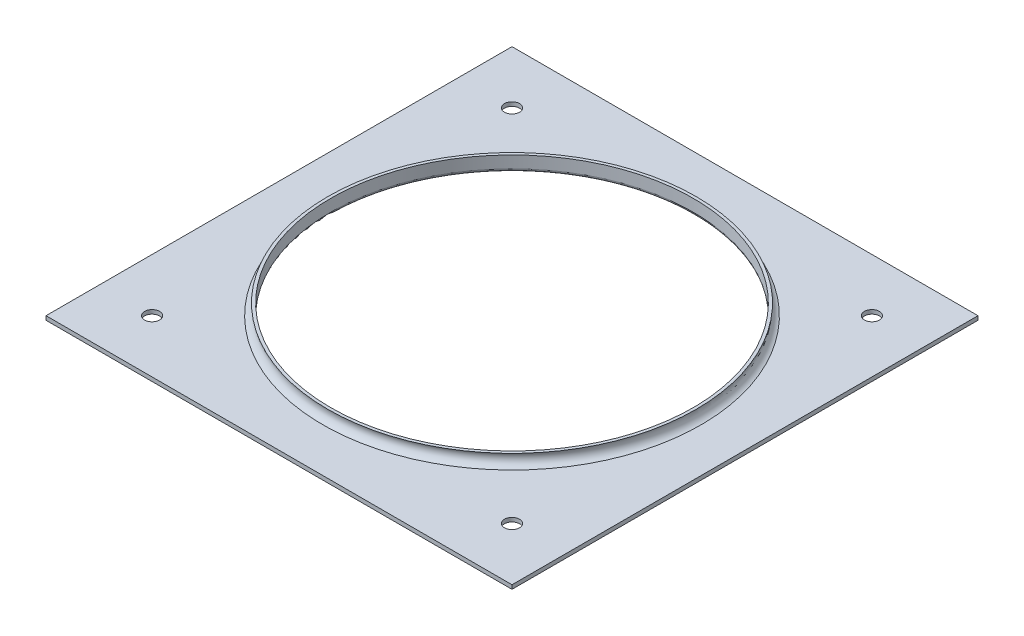
from build123d import *

# Parameters (mm, degrees)
CROQUIS1_W               = 155
CROQUIS1_H               = 155
CROQUIS1_R               = 60.3
SALIENTE_EXTRUIR1_DEPTH  = 8
CORTAR_EXTRUIR4_REACH    = 111.893
CROQUIS3_R               = 3.5
REDONDEO1_R              = 1
CROQUIS5_W               = 161.385983188
CROQUIS5_H               = 158.79059457
CORTAR_EXTRUIR6_DEPTH    = 30
F_5_0_5_DIAMETER_HOLE1_D = 5


with BuildPart() as part:
    # Croquis1 → Saliente-Extruir1 (new body)
    with BuildSketch(Plane(origin=(0, 0, 0), x_dir=(1, 0, 0), z_dir=(0, 1, 0))):
        Rectangle(CROQUIS1_W, CROQUIS1_H)
        Circle(CROQUIS1_R, mode=Mode.SUBTRACT)
    extrude(amount=SALIENTE_EXTRUIR1_DEPTH)

    # Croquis2 → Cortar-Revolución1 (revolve, cut)
    with BuildSketch(Plane.XY):
        with BuildLine():
            Line((63.057831326, 6.474140719), (73.221363367, 6.474140719))
            Line((73.221363367, 6.474140719), (118.605663226, 6.474140719))
            Line((118.605663226, 6.474140719), (118.605663226, 1.329441432))
            Line((118.605663226, 1.329441432), (77.5, 1.329441432))
            Line((77.5, 1.329441432), (62.888920691, 1.329441432))
            ThreePointArc((62.888920691, 1.329441432), (61.030350251, 3.965584448), (63.057831326, 6.474140719))
        make_face()
    revolve(axis=Axis((0, 0, 0), (0, 1, 0)), mode=Mode.SUBTRACT)

    # Croquis3 → Cortar-Extruir4 (cut, up to next)
    with BuildSketch(Plane(origin=(0, 8, 0), x_dir=(1, 0, 0), z_dir=(0, 1, 0)), mode=Mode.PRIVATE) as cortar_extruir4_sk1:
        with Locations((70, 70)):
            Circle(CROQUIS3_R)
    cortar_extruir4_tool1 = extrude(cortar_extruir4_sk1.sketch, amount=-CORTAR_EXTRUIR4_REACH, mode=Mode.PRIVATE) & part.part
    # Croquis3 → Cortar-Extruir4 (cut, up to next)
    with BuildSketch(Plane(origin=(0, 8, 0), x_dir=(1, 0, 0), z_dir=(0, 1, 0)), mode=Mode.PRIVATE) as cortar_extruir4_sk2:
        with Locations((-70, 70)):
            Circle(CROQUIS3_R)
    cortar_extruir4_tool2 = extrude(cortar_extruir4_sk2.sketch, amount=-CORTAR_EXTRUIR4_REACH, mode=Mode.PRIVATE) & part.part
    # Croquis3 → Cortar-Extruir4 (cut, up to next)
    with BuildSketch(Plane(origin=(0, 8, 0), x_dir=(1, 0, 0), z_dir=(0, 1, 0)), mode=Mode.PRIVATE) as cortar_extruir4_sk3:
        with Locations((-70, -70)):
            Circle(CROQUIS3_R)
    cortar_extruir4_tool3 = extrude(cortar_extruir4_sk3.sketch, amount=-CORTAR_EXTRUIR4_REACH, mode=Mode.PRIVATE) & part.part
    # Croquis3 → Cortar-Extruir4 (cut, up to next)
    with BuildSketch(Plane(origin=(0, 8, 0), x_dir=(1, 0, 0), z_dir=(0, 1, 0)), mode=Mode.PRIVATE) as cortar_extruir4_sk4:
        with Locations((70, -70)):
            Circle(CROQUIS3_R)
    cortar_extruir4_tool4 = extrude(cortar_extruir4_sk4.sketch, amount=-CORTAR_EXTRUIR4_REACH, mode=Mode.PRIVATE) & part.part
    add(cortar_extruir4_tool1.solids().sort_by_distance((70, 8, -70))[0], mode=Mode.SUBTRACT)
    add(cortar_extruir4_tool2.solids().sort_by_distance((-70, 8, -70))[0], mode=Mode.SUBTRACT)
    add(cortar_extruir4_tool3.solids().sort_by_distance((-70, 8, 70))[0], mode=Mode.SUBTRACT)
    add(cortar_extruir4_tool4.solids().sort_by_distance((70, 8, 70))[0], mode=Mode.SUBTRACT)

    # Redondeo1
    redondeo1_edges = [part.edges().sort_by_distance(p)[0] for p in [
        (-60.3, 0, 0),
        (-60.3, 8, 0),
    ]]
    fillet(redondeo1_edges, radius=REDONDEO1_R)

    # Croquis5 → Cortar-Extruir6 (cut)
    with BuildSketch(Plane(origin=(0, 5, 0), x_dir=(1, 0, 0), z_dir=(0, 1, 0))):
        Rectangle(CROQUIS5_W, CROQUIS5_H)
    extrude(amount=CORTAR_EXTRUIR6_DEPTH, mode=Mode.SUBTRACT)

    # Ø5.0 (5) Diameter Hole1 (through all)
    with Locations(Plane(origin=(0, 0, 0), x_dir=(-1, 0, 0), z_dir=(0, -1, 0))):
        with Locations((-59.856589027, -59.856589027), (-59.856589027, 59.856589027), (59.856589027, 59.856589027), (59.856589027, -59.856589027)):
            Hole(F_5_0_5_DIAMETER_HOLE1_D / 2)


solid = part.part
